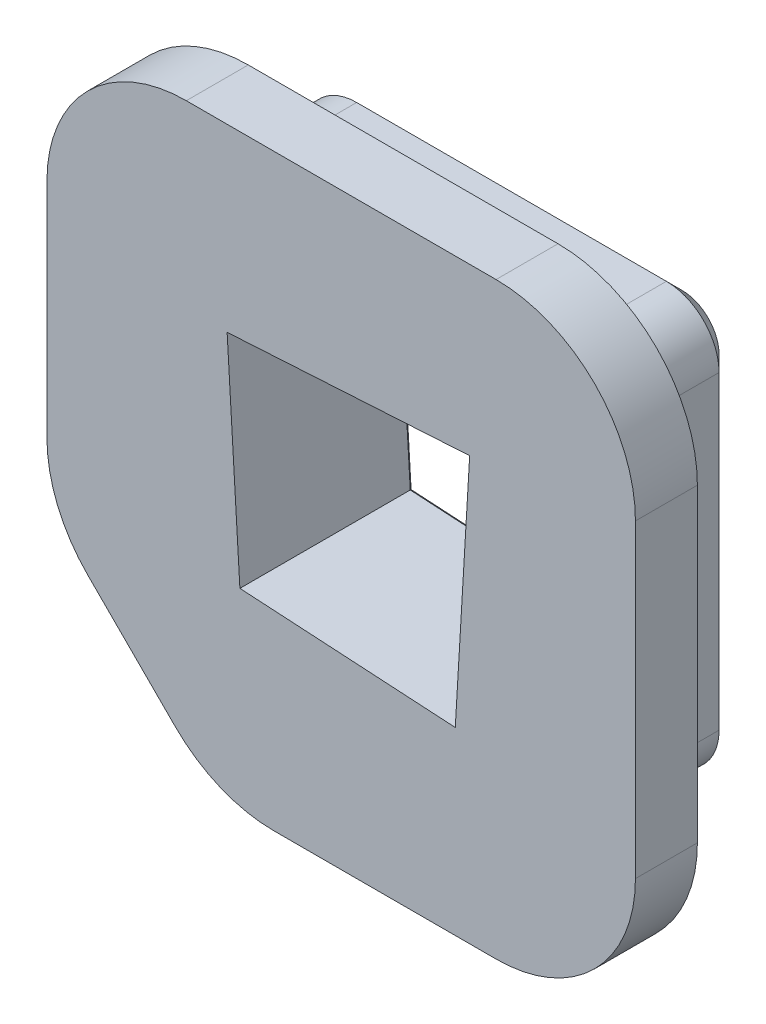
from build123d import *

# Parameters (mm, degrees)
BOSS_EXTRUDE1_DEPTH     = 2
BOSS_EXTRUDE2_DEPTH     = 4
CUT_EXTRUDE1_DEPTH      = 40.05198163
CUT_EXTRUDE1_DEPTH_BACK = 40.05198163
CHAMFER1_SIZE           = 0.5


with BuildPart() as part:
    # Sketch2 → Boss-Extrude1 (new body)
    with BuildSketch(Plane.XY):
        with BuildLine():
            Line((-26.150665133, -23.322238008), (-23.322238008, -26.150665133))
            ThreePointArc((-23.322238008, -26.150665133), (-21.862332939, -27.126142514), (-20.140257493, -27.468684618))
            Line((-20.140257493, -27.468684618), (-12.968684618, -27.468684618))
            ThreePointArc((-12.968684618, -27.468684618), (-9.786704102, -26.150665133), (-8.468684618, -22.968684618))
            Line((-8.468684618, -22.968684618), (-8.468684618, -12.968684618))
            ThreePointArc((-8.468684618, -12.968684618), (-9.786704102, -9.786704102), (-12.968684618, -8.468684618))
            Line((-12.968684618, -8.468684618), (-22.968684618, -8.468684618))
            ThreePointArc((-22.968684618, -8.468684618), (-26.150665133, -9.786704102), (-27.468684618, -12.968684618))
            Line((-27.468684618, -12.968684618), (-27.468684618, -20.140257493))
            ThreePointArc((-27.468684618, -20.140257493), (-27.126142514, -21.862332939), (-26.150665133, -23.322238008))
        make_face()
    extrude(amount=BOSS_EXTRUDE1_DEPTH)

    # Sketch1 → Boss-Extrude2 (add)
    with BuildSketch(Plane.XY):
        with BuildLine():
            Line((-12.968684618, -11.268684618), (-22.968684618, -11.268684618))
            ThreePointArc((-22.968684618, -11.268684618), (-24.170766146, -11.76660309), (-24.668684618, -12.968684618))
            Line((-24.668684618, -12.968684618), (-24.668684618, -20.140257493))
            ThreePointArc((-24.668684618, -20.140257493), (-24.539279823, -20.790819328), (-24.170766146, -21.342339021))
            Line((-24.170766146, -21.342339021), (-21.342339021, -24.170766146))
            ThreePointArc((-21.342339021, -24.170766146), (-20.790819328, -24.539279823), (-20.140257493, -24.668684618))
            Line((-20.140257493, -24.668684618), (-12.968684618, -24.668684618))
            ThreePointArc((-12.968684618, -24.668684618), (-11.76660309, -24.170766146), (-11.268684618, -22.968684618))
            Line((-11.268684618, -22.968684618), (-11.268684618, -12.968684618))
            ThreePointArc((-11.268684618, -12.968684618), (-11.76660309, -11.76660309), (-12.968684618, -11.268684618))
        make_face()
    extrude(amount=-BOSS_EXTRUDE2_DEPTH)

    # Sketch3 → Cut-Extrude1 (cut, two sides: drawn at the far end of the back side and taken through both)
    with BuildSketch(Plane.XY.offset(-CUT_EXTRUDE1_DEPTH_BACK)):
        Polygon((-21.651793969, -14.285575267), (-13.820598007, -13.820598007), (-14.285575267, -21.651793969), (-21.238938053, -21.238938053), align=None)
    extrude(amount=CUT_EXTRUDE1_DEPTH + CUT_EXTRUDE1_DEPTH_BACK, mode=Mode.SUBTRACT)

    # Chamfer1
    chamfer1_edges = [part.edges().sort_by_distance(p)[0] for p in [
        (-24.539279823, -20.790819328, -4),
        (-22.756552583, -22.756552583, -4),
        (-24.668684618, -16.554471055, -4),
        (-20.790819328, -24.539279823, -4),
        (-24.170766146, -11.76660309, -4),
        (-16.554471055, -24.668684618, -4),
        (-17.968684618, -11.268684618, -4),
        (-11.76660309, -24.170766146, -4),
        (-11.76660309, -11.76660309, -4),
        (-11.268684618, -17.968684618, -4),
        (-14.053086637, -17.736195988, -4),
        (-17.736195988, -14.053086637, -4),
        (-21.445366011, -17.76225666, -4),
        (-17.76225666, -21.445366011, -4),
    ]]
    chamfer(chamfer1_edges, length=CHAMFER1_SIZE)


solid = part.part
